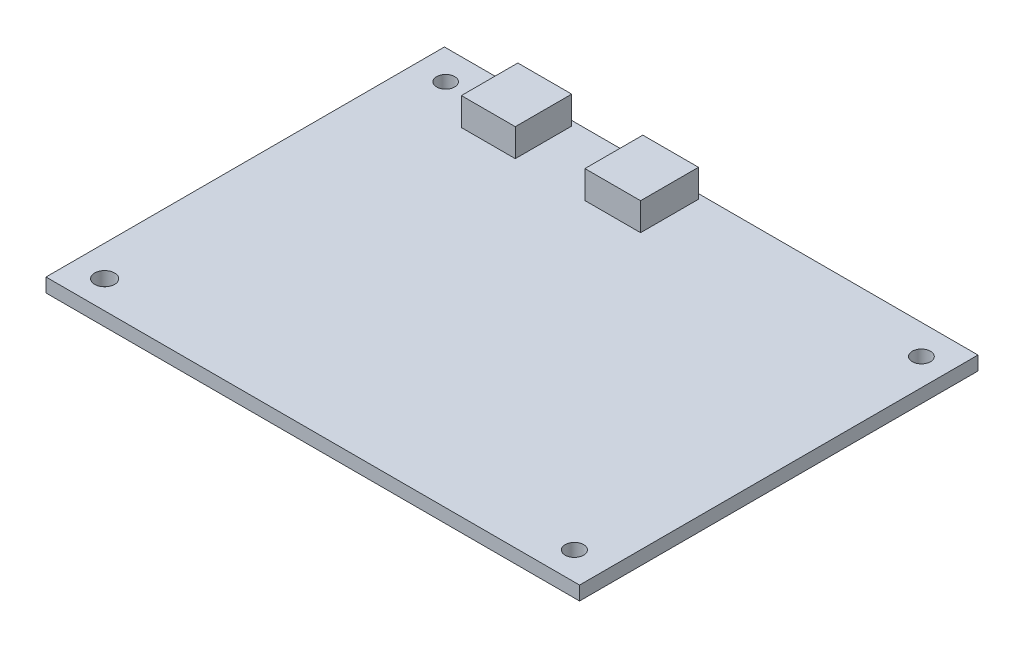
from build123d import *

# Parameters (mm, degrees)
ESBO_O1_W                = 77
ESBO_O1_H                = 57.5
RESSALTO_EXTRUS_O1_DEPTH = 2
ESBO_O2_W                = 7.7755798
ESBO_O2_H                = 8.143597904
ESBO_O2_W_2              = 8.031877
ESBO_O2_H_2              = 8.356901944
RESSALTO_EXTRUS_O2_DEPTH = 4
CASCA1_START             = -28.041915429
CASCA1_OUTLINE_W         = 6.031877
CASCA1_OUTLINE_H         = 4
CASCA1_OUTLINE_W_2       = 5.7755798
CASCA1_DEPTH             = 7.143597904
CASCA1_START_2           = -28.045301573
CASCA1_2_OUTLINE_W       = 6.031877
CASCA1_2_OUTLINE_H       = 4
CASCA1_2_DEPTH           = 7.356901944
ESBO_O3_R                = 1.331315802
ESBO_O3_R_2              = 1.316034484
ESBO_O3_R_3              = 1.436459579
ESBO_O3_R_4              = 1.302946869
CORTE_EXTRUS_O1_DEPTH    = 49.216309481


# Read off the part's stored shape, not the designer's step: Casca1
with BuildPart() as part:
    # Esboço1 → Ressalto-extrusão1 (new body)
    with BuildSketch(Plane(origin=(0, 0, 0), x_dir=(1, 0, 0), z_dir=(0, 1, 0))):
        Rectangle(ESBO_O1_W, ESBO_O1_H)
    extrude(amount=RESSALTO_EXTRUS_O1_DEPTH)

    # Esboço2 → Ressalto-extrusão2 (add)
    with BuildSketch(Plane(origin=(0, 2, 0), x_dir=(1, 0, 0), z_dir=(0, 1, 0))):
        with Locations((-23.313874366, 23.970116477)):
            Rectangle(ESBO_O2_W, ESBO_O2_H)
        with Locations((-5.149923387, 23.866850601)):
            Rectangle(ESBO_O2_W_2, ESBO_O2_H_2)
    extrude(amount=RESSALTO_EXTRUS_O2_DEPTH)

    # Casca1 outline → Casca1 (cut)
    with BuildSketch(Plane.XY.offset(CASCA1_START)):
        with Locations((-5.149923387, 3)):
            Rectangle(CASCA1_OUTLINE_W, CASCA1_OUTLINE_H)
        with Locations((-23.313874366, 3)):
            Rectangle(CASCA1_OUTLINE_W_2, CASCA1_OUTLINE_H)
    extrude(amount=CASCA1_DEPTH, mode=Mode.SUBTRACT)

    # Casca1 2 outline → Casca1 2 (cut)
    with BuildSketch(Plane.XY.offset(CASCA1_START_2)):
        with Locations((-5.149923387, 3)):
            Rectangle(CASCA1_2_OUTLINE_W, CASCA1_2_OUTLINE_H)
    extrude(amount=CASCA1_2_DEPTH, mode=Mode.SUBTRACT)

    # Esboço3 → Corte-extrusão1 (cut, through all)
    with BuildSketch(Plane(origin=(0, 2, 0), x_dir=(1, 0, 0), z_dir=(0, 1, 0))):
        with Locations(Location((33.733228093, -24.729326676, 0), (0, 0, 270))):
            Circle(ESBO_O3_R)
        with Locations(Location((34.598509611, 24.48523075, 0), (0, 0, 270))):
            Circle(ESBO_O3_R_2)
        with Locations(Location((-34.058204813, -24.729326676, 0), (0, 0, 270))):
            Circle(ESBO_O3_R_3)
        with Locations(Location((-34.058204813, 24.48523075, 0), (0, 0, 270))):
            Circle(ESBO_O3_R_4)
    extrude(amount=-CORTE_EXTRUS_O1_DEPTH, mode=Mode.SUBTRACT)


solid = part.part
